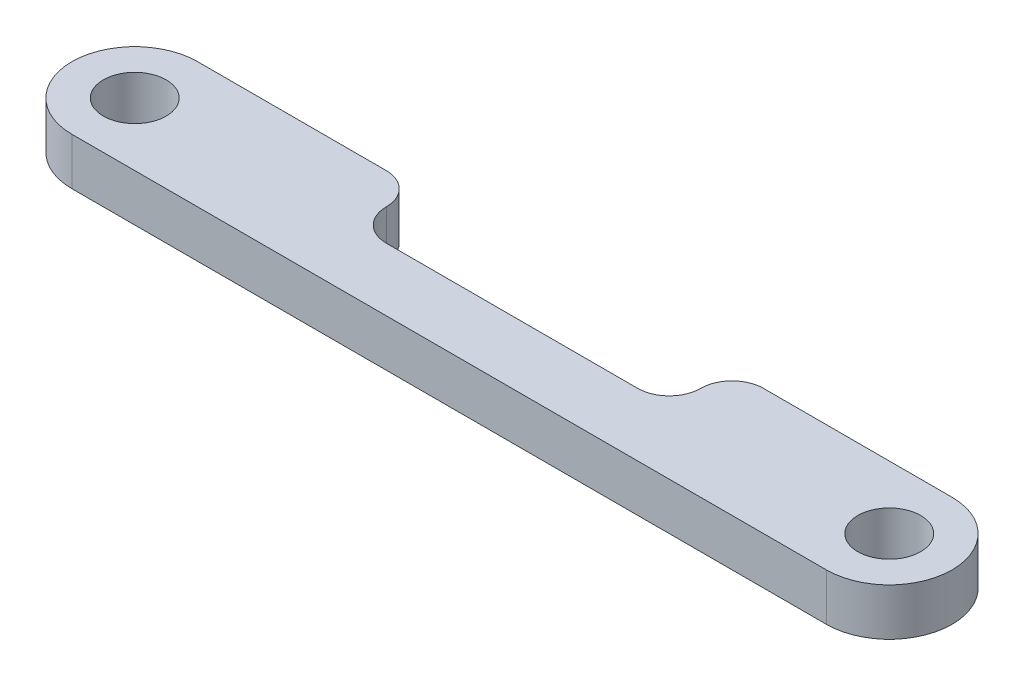
from build123d import *

# Parameters (mm, degrees)
SKETCH1_R           = 1.27
BOSS_EXTRUDE1_DEPTH = 1.905
FILLET1_START       = -1
FILLET1_DEPTH       = 4
FILLET1_2_DEPTH     = 1.905


with BuildPart() as part:
    # Sketch1 → Boss-Extrude1 (new body)
    with BuildSketch(Plane(origin=(0, 0, 0), x_dir=(1, 0, 0), z_dir=(0, 1, 0))):
        with BuildLine():
            Line((6.35, 2.54), (6.35, 0))
            Line((6.35, 0), (-6.35, 0))
            Line((-6.35, 0), (-6.35, 2.54))
            Line((-6.35, 2.54), (-15.24, 2.54))
            ThreePointArc((-15.24, 2.54), (-17.78, 0), (-15.24, -2.54))
            Line((-15.24, -2.54), (15.24, -2.54))
            ThreePointArc((15.24, -2.54), (17.78, 0), (15.24, 2.54))
            Line((15.24, 2.54), (6.35, 2.54))
        make_face()
        with Locations(Location((-15.24, 0, 0), (0, 0, 90))):
            Circle(SKETCH1_R, mode=Mode.SUBTRACT)
        with Locations(Location((15.24, 0, 0), (0, 0, 90))):
            Circle(SKETCH1_R, mode=Mode.SUBTRACT)
    extrude(amount=BOSS_EXTRUDE1_DEPTH)

    # Fillet1: read off the stored shape, not the designer's step
    # Fillet1 outline → Fillet1 (cut)
    with BuildSketch(Plane(origin=(0, 0, 0), x_dir=(1, 0, 0), z_dir=(0, 1, 0)).offset(FILLET1_START)):
        with BuildLine():
            Line((6.35, 2.54), (6.35, 1.27))
            ThreePointArc((6.35, 1.27), (6.721974388, 2.168025612), (7.62, 2.54))
            Line((7.62, 2.54), (6.35, 2.54))
        make_face()
        with BuildLine():
            ThreePointArc((-7.62, 2.54), (-6.721974388, 2.168025612), (-6.35, 1.27))
            Line((-6.35, 1.27), (-6.35, 2.54))
            Line((-6.35, 2.54), (-7.62, 2.54))
        make_face()
    extrude(amount=FILLET1_DEPTH, mode=Mode.SUBTRACT)

    # Fillet1 2 outline → Fillet1 2 (add)
    with BuildSketch(Plane(origin=(0, 0, 0), x_dir=(1, 0, 0), z_dir=(0, 1, 0))):
        with BuildLine():
            Line((-6.35, 0), (-5.08, 0))
            ThreePointArc((-5.08, 0), (-5.978025612, 0.371974388), (-6.35, 1.27))
            Line((-6.35, 1.27), (-6.35, 0))
        make_face()
        with BuildLine():
            ThreePointArc((6.35, 1.27), (5.978025612, 0.371974388), (5.08, 0))
            Line((5.08, 0), (6.35, 0))
            Line((6.35, 0), (6.35, 1.27))
        make_face()
    extrude(amount=FILLET1_2_DEPTH)


solid = part.part
